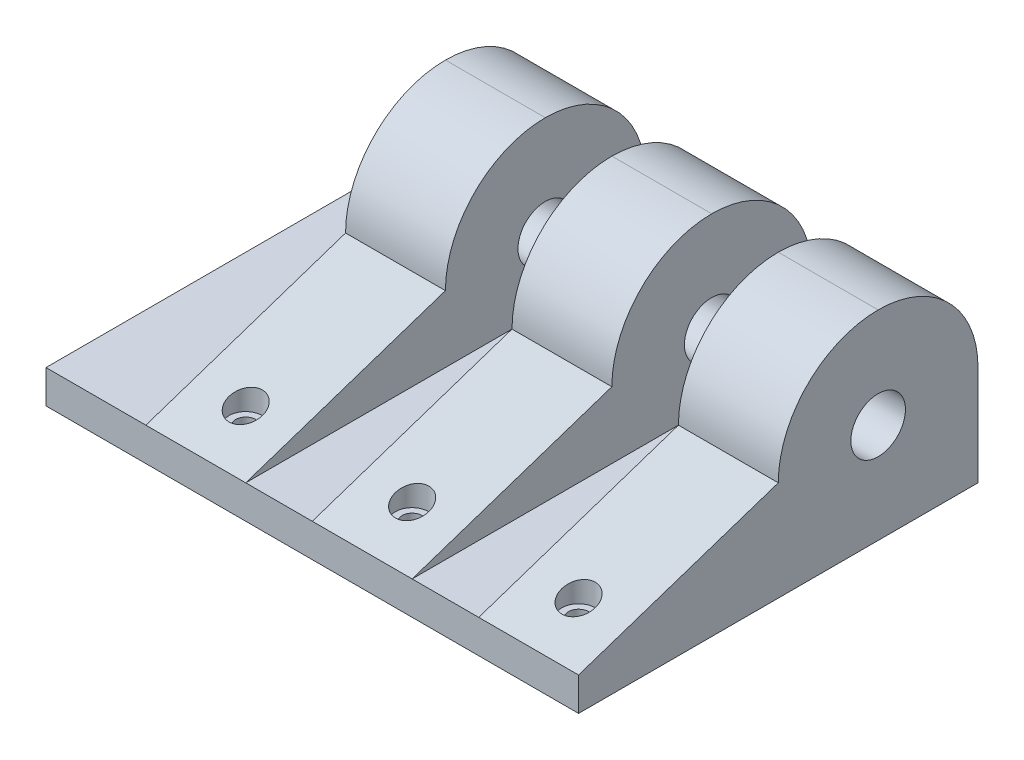
from build123d import *
from OCP.BRepFilletAPI import BRepFilletAPI_MakeChamfer

# Parameters (mm, degrees)
SKETCH1_W           = 80
SKETCH1_H           = 60
BOSS_EXTRUDE2_DEPTH = 5
SKETCH3_W           = 15
SKETCH3_H           = 30
BOSS_EXTRUDE3_DEPTH = 25
SKETCH5_R           = 4.1
CUT_EXTRUDE2_DEPTH  = 105.403065089
CHAMFER1_SIZE       = 30
CHAMFER1_SIZE_2     = 10
FILLET1_R           = 15
SKETCH6_R           = 1.5
CUT_EXTRUDE3_DEPTH  = 105.403065089
SKETCH8_R           = 2.5
CUT_EXTRUDE5_DEPTH  = 104.07764064


with BuildPart() as part:
    # Sketch1 → Boss-Extrude2 (new body)
    with BuildSketch(Plane(origin=(0, 0, 0), x_dir=(1, 0, 0), z_dir=(0, 1, 0))):
        with Locations((40, 30)):
            Rectangle(SKETCH1_W, SKETCH1_H)
    extrude(amount=BOSS_EXTRUDE2_DEPTH)

    # Sketch3 → Boss-Extrude3 (add)
    with BuildSketch(Plane(origin=(0, 5, 0), x_dir=(1, 0, 0), z_dir=(0, 1, 0))):
        with Locations((72.5, 45)):
            Rectangle(SKETCH3_W, SKETCH3_H)
        with Locations((47.5, 45)):
            Rectangle(SKETCH3_W, SKETCH3_H)
        with Locations((22.5, 45)):
            Rectangle(SKETCH3_W, SKETCH3_H)
    extrude(amount=BOSS_EXTRUDE3_DEPTH)

    # Sketch5 → Cut-Extrude2 (cut, through all)
    with BuildSketch(Plane(origin=(80, 0, 0), x_dir=(0, 0, -1), z_dir=(1, 0, 0))):
        with Locations((45, 15)):
            Circle(SKETCH5_R)
    extrude(amount=-CUT_EXTRUDE2_DEPTH, mode=Mode.SUBTRACT)

    # Chamfer1
    chamfer1_edges_1 = [part.edges().sort_by_distance(p)[0] for p in [
        (72.5, 5, -30),
    ]]
    chamfer1_side_1 = [part.faces().sort_by_distance(p)[0] for p in [
        (72.5, 5, -29.8),
    ]]
    chamfer1_edges_2 = [part.edges().sort_by_distance(p)[0] for p in [
        (47.5, 5, -30),
    ]]
    chamfer1_side_2 = [part.faces().sort_by_distance(p)[0] for p in [
        (47.5, 5, -29.8),
    ]]
    chamfer1_edges_3 = [part.edges().sort_by_distance(p)[0] for p in [
        (22.5, 5, -30),
    ]]
    chamfer1_side_3 = [part.faces().sort_by_distance(p)[0] for p in [
        (22.5, 5, -29.8),
    ]]
    chamfer1 = BRepFilletAPI_MakeChamfer(part.part.solid().wrapped)
    for e in chamfer1_edges_1:
        chamfer1.Add(CHAMFER1_SIZE - 0.0001, CHAMFER1_SIZE_2 - 0.0001, e.wrapped, chamfer1_side_1[0].wrapped)
    for e in chamfer1_edges_2:
        chamfer1.Add(CHAMFER1_SIZE - 0.0001, CHAMFER1_SIZE_2 - 0.0001, e.wrapped, chamfer1_side_2[0].wrapped)
    for e in chamfer1_edges_3:
        chamfer1.Add(CHAMFER1_SIZE - 0.0001, CHAMFER1_SIZE_2 - 0.0001, e.wrapped, chamfer1_side_3[0].wrapped)
    add(Compound.cast(chamfer1.Shape()), mode=Mode.REPLACE)  # a hair under: the kernel refuses the full size

    # Fillet1
    fillet1_edges = [part.edges().sort_by_distance(p)[0] for p in [
        (72.5, 30, -60),
        (47.5, 30, -60),
        (72.5, 30, -30),
        (47.5, 30, -30),
        (22.5, 30, -60),
        (22.5, 30, -30),
    ]]
    fillet(fillet1_edges, radius=FILLET1_R - 0.0001)  # a hair under: the kernel refuses the full size

    # Sketch6 → Cut-Extrude3 (cut, through all)
    with BuildSketch(Plane.XZ):
        with Locations(Location((72.5, -7.5, 0), (0, 0, 270))):
            Circle(SKETCH6_R)
        with Locations(Location((47.5, -7.5, 0), (0, 0, 270))):
            Circle(SKETCH6_R)
        with Locations(Location((22.5, -7.5, 0), (0, 0, 270))):
            Circle(SKETCH6_R)
    extrude(amount=-CUT_EXTRUDE3_DEPTH, mode=Mode.SUBTRACT)

    # Sketch8 → Cut-Extrude5 (cut, through all)
    with BuildSketch(Plane(origin=(0, 5, 0), x_dir=(1, 0, 0), z_dir=(0, 1, 0))):
        with Locations(Location((22.5, 7.5, 0), (0, 0, 270))):
            Circle(SKETCH8_R)
        with Locations(Location((47.5, 7.5, 0), (0, 0, 270))):
            Circle(SKETCH8_R)
        with Locations(Location((72.5, 7.5, 0), (0, 0, 270))):
            Circle(SKETCH8_R)
    extrude(amount=CUT_EXTRUDE5_DEPTH, mode=Mode.SUBTRACT)


solid = part.part
